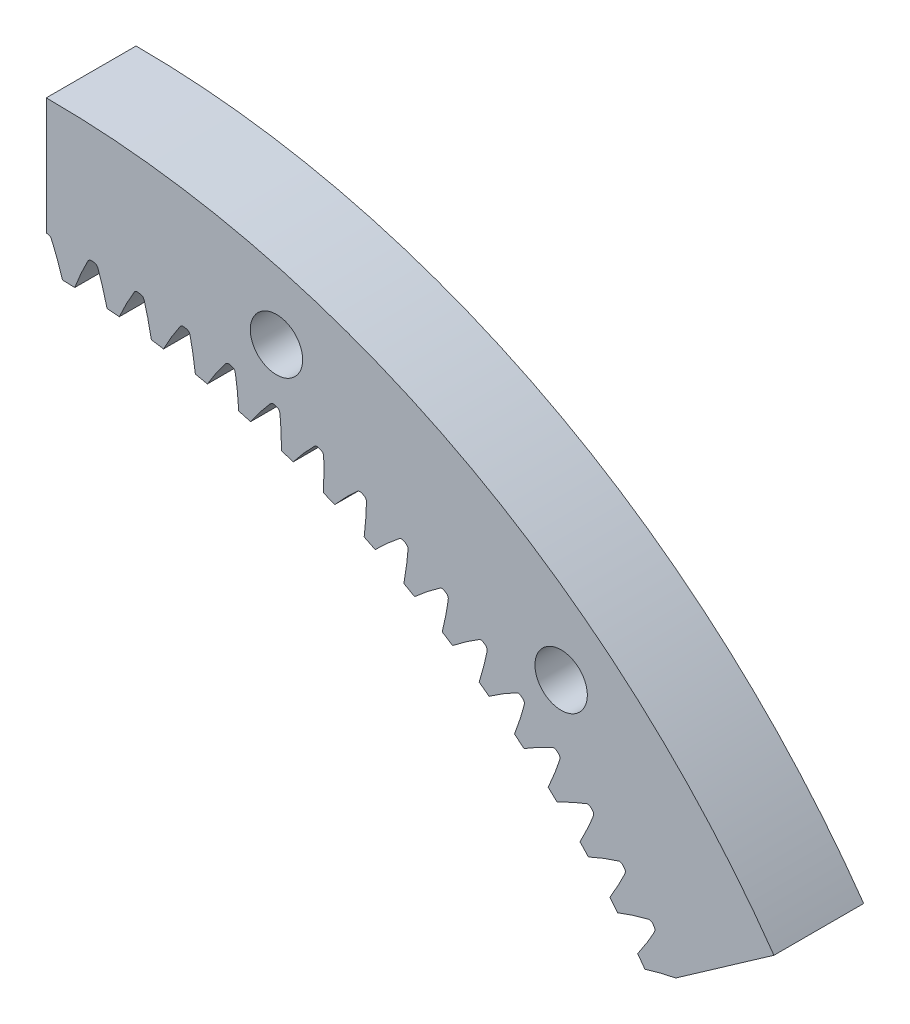
from build123d import *

# Parameters (mm, degrees)
SKETCHREVOLVESPURASSEMBLYNEW2GEAR_W       = 6
SKETCHREVOLVESPURASSEMBLYNEW2GEAR_H       = 10
TOOTHEXTRUDECUTSPURASSEMBLYNEW2GEAR_DEPTH = 4
PATTERNSPURASSEMBLYNEW2GEAR_COUNT         = 104
SKETCH_1_R                                = 1.75
CUT_EXTRUDE_1_DEPTH                       = 85.216931583


with BuildPart() as part:
    # SketchRevolveSpurAssemblyNew2Gear → SpurAssemblyNew2Gear (revolve)
    with BuildSketch(Plane(origin=(0, 0, 0), x_dir=(0, 0, -1), z_dir=(1, 0, 0))):
        with Locations((1, 54.399038462)):
            Rectangle(SKETCHREVOLVESPURASSEMBLYNEW2GEAR_W, SKETCHREVOLVESPURASSEMBLYNEW2GEAR_H)
    revolve(axis=Axis((0, 0, 0), (0, 0, -1)))

    # SketchToothSpurAssemblyNew2Gear → ToothExtrudeCutSpurAssemblyNew2Gear (cut, symmetric)
    with BuildSketch(Plane.XY):
        with BuildLine():
            ThreePointArc((49.139463497, -1.153700519), (49.153004971, 0), (49.139463497, 1.153700519))
            add(Edge.make_bspline(
                [(49.139463497, 1.153700519), (49.286109569, 1.112375592), (49.510220487, 1.045389162), (49.813750924, 0.947309864), (50.055449758, 0.865152603), (50.305972537, 0.775805702), (50.565072037, 0.678785835), (50.832899739, 0.574601978), (51.108000952, 0.459863429), (51.309373521, 0.380423551), (51.427190703, 0.322446544), (51.461136128, 0.297293766), (51.491079607, 0.26803453), (51.516447876, 0.234674807), (51.536698627, 0.198013634), (51.556477606, 0.146135037), (51.563300975, 0.091574007), (51.562323517, 0.038492677), (51.562588241, 0), (51.562323517, -0.038492677), (51.563300975, -0.091574007), (51.556477606, -0.146135037), (51.536698627, -0.198013634), (51.516447876, -0.234674807), (51.491079607, -0.26803453), (51.461136128, -0.297293766), (51.427190703, -0.322446544), (51.309373521, -0.380423551), (51.108000952, -0.459863429), (50.832899739, -0.574601978), (50.565072037, -0.678785835), (50.305972537, -0.775805702), (50.055449758, -0.865152603), (49.813750924, -0.947309864), (49.510220487, -1.045389162), (49.286109569, -1.112375592), (49.139463497, -1.153700519)],
                knots=[0, 0, 0, 0, 0.081489338, 0.125094302, 0.170606129, 0.218024819, 0.267350371, 0.318582787, 0.371722066, 0.426768208, 0.434364679, 0.441808018, 0.449251357, 0.456694696, 0.464138034, 0.471581373, 0.486277069, 0.493138537, 0.5, 0.506861463, 0.513722931, 0.528418627, 0.535861966, 0.543305304, 0.550748643, 0.558191982, 0.565635321, 0.573231792, 0.628277934, 0.681417213, 0.732649629, 0.781975181, 0.829393871, 0.874905698, 0.918510662, 1, 1, 1, 1], degree=3))
        make_face()
    toothextrudecutspurassemblynew2gear = extrude(amount=TOOTHEXTRUDECUTSPURASSEMBLYNEW2GEAR_DEPTH, both=True, mode=Mode.SUBTRACT)

    # PatternSpurAssemblyNew2Gear: ToothExtrudeCutSpurAssemblyNew2Gear ×104 about axis
    patternspurassemblynew2gear_axis = Axis((0, 0, 50), (0, 0, -1))
    for i in range(1, PATTERNSPURASSEMBLYNEW2GEAR_COUNT):
        add(toothextrudecutspurassemblynew2gear.rotate(patternspurassemblynew2gear_axis, i * 360 / PATTERNSPURASSEMBLYNEW2GEAR_COUNT), mode=Mode.SUBTRACT)

    # Эскиз1 → Вырез-Вытянуть1 (cut, through all)
    with BuildSketch(Plane.XY.offset(2)):
        with Locations((15.390595772, 52.802741991)):
            Circle(SKETCH_1_R)
        with Locations((34.42579097, 42.89364657)):
            Circle(SKETCH_1_R)
        with BuildLine():
            Line((0, 0), (0, 72.303537868))
            ThreePointArc((0, 72.303537868), (-33.386058343, -64.134021366), (59.227590854, 41.471605586))
            Line((59.227590854, 41.471605586), (0, 0))
        make_face()
    extrude(amount=-CUT_EXTRUDE_1_DEPTH, mode=Mode.SUBTRACT)


solid = part.part
